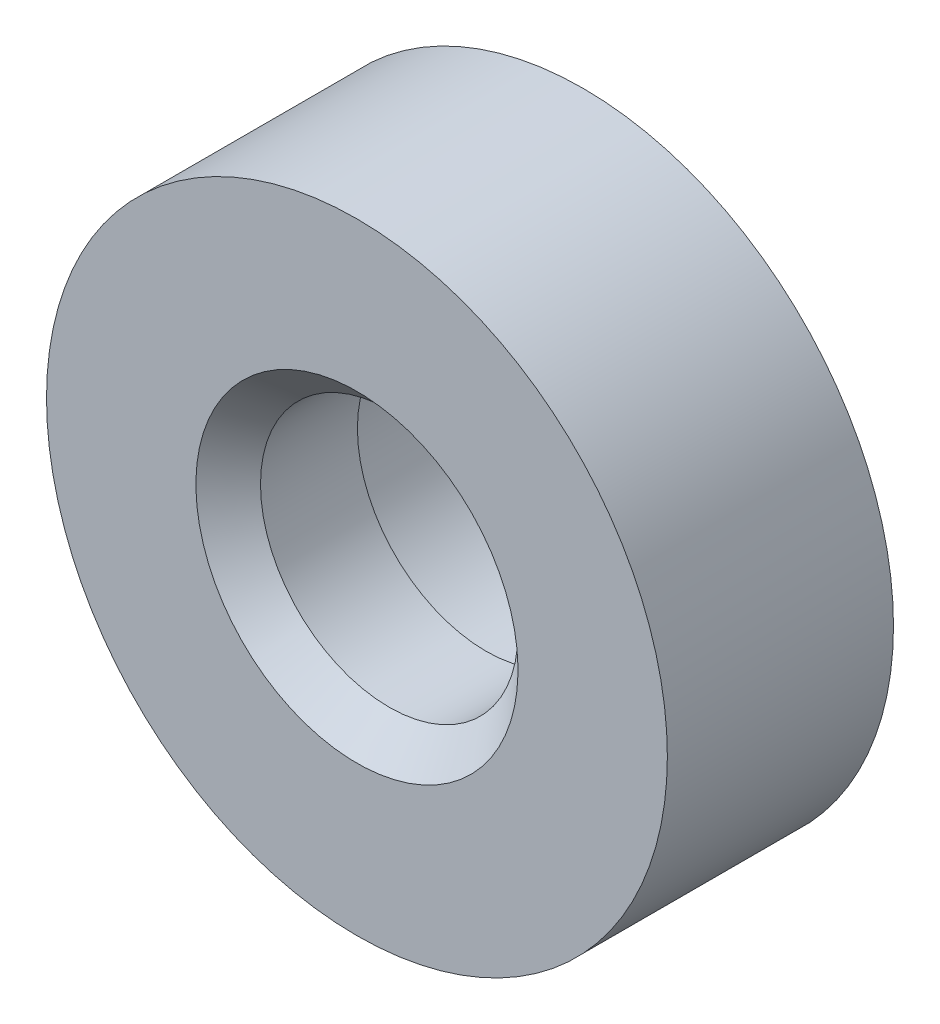
from build123d import *

# Parameters (mm, degrees)
SKETCH2_R               = 9.61
SKETCH2_R_2             = 3.985714286
SKETCH2_R_3             = 1.55
BOSS_EXTRUDE2_DEPTH     = 7
SKETCH3_R               = 4.5
BOSS_EXTRUDE3_DEPTH     = 3
SKETCH4_R               = 4.5
CUT_EXTRUDE1_DEPTH      = 6
CHAMFER3_SIZE           = 1
BOSS_EXTRUDE4_START     = -3
BOSS_EXTRUDE4_OUTLINE_R = 1.55
BOSS_EXTRUDE4_DEPTH     = 3


# Read off the part's stored shape, not the designer's step: Boss-Extrude4
with BuildPart() as part:
    # Sketch2 → Boss-Extrude2 (new body)
    with BuildSketch(Plane.XY.offset(-179.459781676)):
        Circle(SKETCH2_R)
        Circle(SKETCH2_R_2, mode=Mode.SUBTRACT)
        with Locations((6.731428571, 0)):
            Circle(SKETCH2_R_3, mode=Mode.SUBTRACT)
        with Locations((-6.731428571, 0)):
            Circle(SKETCH2_R_3, mode=Mode.SUBTRACT)
    extrude(amount=BOSS_EXTRUDE2_DEPTH)

    # Sketch3 → Boss-Extrude3 (add)
    with BuildSketch(Plane(origin=(0, 0, -179.459781676), x_dir=(-1, 0, 0), z_dir=(0, 0, -1))):
        Circle(SKETCH3_R)
    extrude(amount=-BOSS_EXTRUDE3_DEPTH)

    # Sketch4 → Cut-Extrude1 (cut)
    with BuildSketch(Plane.XY.offset(-176.459781676)):
        Circle(SKETCH4_R)
    extrude(amount=-CUT_EXTRUDE1_DEPTH, mode=Mode.SUBTRACT)

    # Chamfer3
    chamfer3_edges = [part.edges().sort_by_distance(p)[0] for p in [
        (-3.985714286, 0, -172.459781676),
    ]]
    chamfer(chamfer3_edges, length=CHAMFER3_SIZE)

    # Boss-Extrude4 outline → Boss-Extrude4 (add)
    with BuildSketch(Plane.XY.offset(-172.459781676).offset(BOSS_EXTRUDE4_START)):
        with Locations((6.731428571, 0)):
            Circle(BOSS_EXTRUDE4_OUTLINE_R)
        with Locations((-6.731428571, 0)):
            Circle(BOSS_EXTRUDE4_OUTLINE_R)
    extrude(amount=BOSS_EXTRUDE4_DEPTH)


solid = part.part
